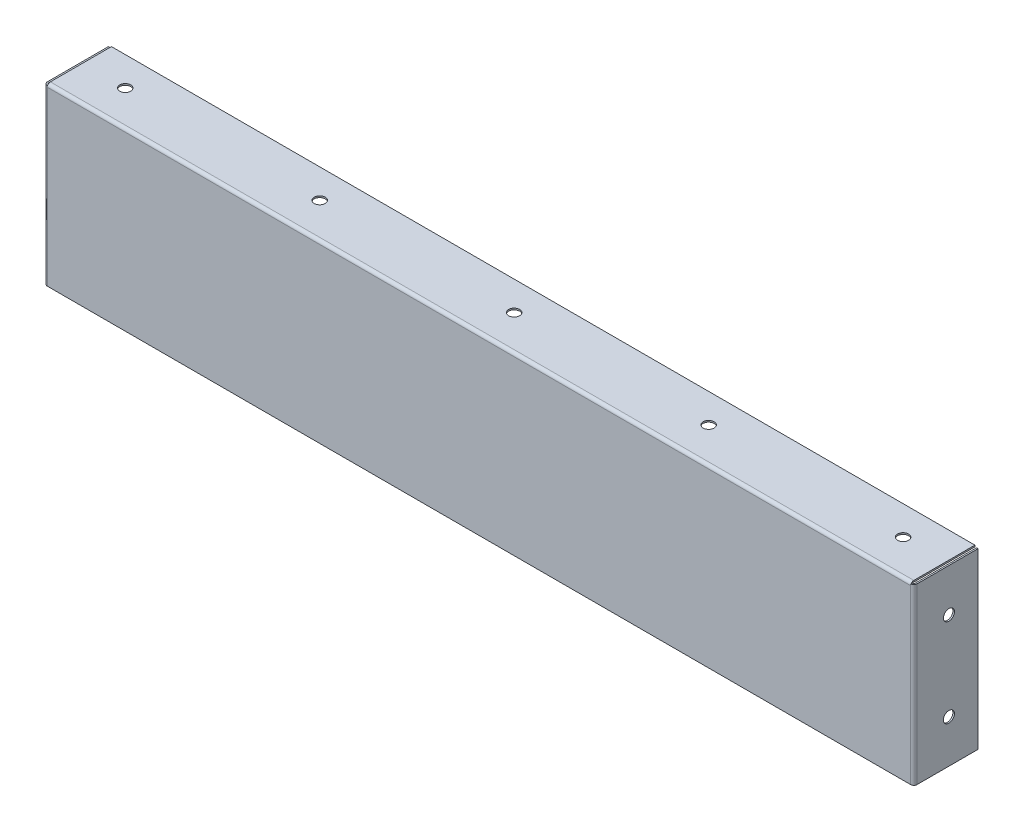
from build123d import *

# Parameters (mm, degrees)
SKETCH1_W                    = 514.4008
SKETCH1_H                    = 103.2002
BOSS_EXTRUDE1_DEPTH          = 1.6002
CONVERT_SOLID1_OUTLINE_W     = 514.4008
CONVERT_SOLID1_OUTLINE_H     = 103.2002
CONVERT_SOLID1_DEPTH         = 0.6858
EDGE_FLANGE1_STRIP_W         = 5.4864
EDGE_FLANGE1_STRIP_H         = 0.9144
EDGE_FLANGE1_STRIP_CUT_DEPTH = 103.2002
EDGE_FLANGE1_DEPTH           = 103.2002
EDGE_FLANGE2_STRIP_W         = 5.4864
EDGE_FLANGE2_STRIP_H         = 0.9144
EDGE_FLANGE2_STRIP_CUT_DEPTH = 103.2002
EDGE_FLANGE2_DEPTH           = 103.2002
CUT_EXTRUDE3_DEPTH           = 521.084421643
CUT_EXTRUDE3_DEPTH_BACK      = 521.084421643
SKETCH18_R                   = 3.2639
EDGE_FLANGE3_STRIP_W         = 5.4864
EDGE_FLANGE3_STRIP_H         = 0.9144
EDGE_FLANGE3_STRIP_CUT_DEPTH = 512.572
EDGE_FLANGE3_DEPTH           = 512.572
SKETCH22_R                   = 3.2639
CUT_EXTRUDE4_DEPTH           = 2.54


# Read off the part's stored shape, not the designer's step: Convert-Solid1
# Sheet-metal steps are written as plain solids
with BuildPart() as part:
    # Sketch1 → Boss-Extrude1 (new body)
    with BuildSketch(Plane.XY):
        Rectangle(SKETCH1_W, SKETCH1_H)
    extrude(amount=BOSS_EXTRUDE1_DEPTH)

    # Convert-Solid1 outline → Convert-Solid1 (cut)
    with BuildSketch(Plane.XY):
        Rectangle(CONVERT_SOLID1_OUTLINE_W, CONVERT_SOLID1_OUTLINE_H)
    extrude(amount=CONVERT_SOLID1_DEPTH, mode=Mode.SUBTRACT)

    # Edge-Flange1 strip (across the edge) → Edge-Flange1 strip cut (cut)
    with BuildSketch(Plane(origin=(257.2004, 51.6001, 0.6858), x_dir=(-1, 0, 0), z_dir=(0, -1, 0))):
        with Locations((-1.8288, -0.4572)):
            Rectangle(EDGE_FLANGE1_STRIP_W, EDGE_FLANGE1_STRIP_H)
    extrude(amount=EDGE_FLANGE1_STRIP_CUT_DEPTH, mode=Mode.SUBTRACT)

    # Edge-Flange1 section (across the edge) → Edge-Flange1 (add)
    with BuildSketch(Plane(origin=(257.2004, 51.6001, 0.6858), x_dir=(-1, 0, 0), z_dir=(0, -1, 0))):
        with BuildLine():
            Line((-0.9144, 0.9144), (-0.9144, 37.1856))
            Line((-0.9144, 37.1856), (0, 37.1856))
            Line((0, 37.1856), (0, 0.9144))
            ThreePointArc((0, 0.9144), (0.267821559, 0.267821559), (0.9144, 0))
            Line((0.9144, 0), (0.9144, -0.9144))
            ThreePointArc((0.9144, -0.9144), (-0.378756881, -0.378756881), (-0.9144, 0.9144))
        make_face()
    extrude(amount=EDGE_FLANGE1_DEPTH)

    # Edge-Flange2 strip (across the edge) → Edge-Flange2 strip cut (cut)
    with BuildSketch(Plane(origin=(-257.2004, -51.6001, 0.6858), x_dir=(1, 0, 0), z_dir=(0, 1, 0))):
        with Locations((-1.8288, -0.4572)):
            Rectangle(EDGE_FLANGE2_STRIP_W, EDGE_FLANGE2_STRIP_H)
    extrude(amount=EDGE_FLANGE2_STRIP_CUT_DEPTH, mode=Mode.SUBTRACT)

    # Edge-Flange2 section (across the edge) → Edge-Flange2 (add)
    with BuildSketch(Plane(origin=(-257.2004, -51.6001, 0.6858), x_dir=(1, 0, 0), z_dir=(0, 1, 0))):
        with BuildLine():
            Line((-0.9144, 0.9144), (-0.9144, 37.1856))
            Line((-0.9144, 37.1856), (0, 37.1856))
            Line((0, 37.1856), (0, 0.9144))
            ThreePointArc((0, 0.9144), (0.267821559, 0.267821559), (0.9144, 0))
            Line((0.9144, 0), (0.9144, -0.9144))
            ThreePointArc((0.9144, -0.9144), (-0.378756881, -0.378756881), (-0.9144, 0.9144))
        make_face()
    extrude(amount=EDGE_FLANGE2_DEPTH)

    # Sketch18 → Cut-Extrude3 (cut, two sides: drawn at the far end of the back side and taken through both)
    with BuildSketch(Plane.ZY.offset(258.1148).offset(-CUT_EXTRUDE3_DEPTH_BACK)):
        with Locations(Location((-19.244729261, 26.2001, 0), (0, 0, 180))):
            Circle(SKETCH18_R)
        with Locations(Location((-19.244729261, -26.2001, 0), (0, 0, 180))):
            Circle(SKETCH18_R)
    extrude(amount=CUT_EXTRUDE3_DEPTH + CUT_EXTRUDE3_DEPTH_BACK, mode=Mode.SUBTRACT)

    # Edge-Flange3 strip (across the edge) → Edge-Flange3 strip cut (cut)
    with BuildSketch(Plane(origin=(-256.286, 51.6001, 0.6858), x_dir=(0, -1, 0), z_dir=(1, 0, 0))):
        with Locations((-1.8288, -0.4572)):
            Rectangle(EDGE_FLANGE3_STRIP_W, EDGE_FLANGE3_STRIP_H)
    extrude(amount=EDGE_FLANGE3_STRIP_CUT_DEPTH, mode=Mode.SUBTRACT)

    # Edge-Flange3 section (across the edge) → Edge-Flange3 (add)
    with BuildSketch(Plane(origin=(-256.286, 51.6001, 0.6858), x_dir=(0, -1, 0), z_dir=(1, 0, 0))):
        with BuildLine():
            Line((-0.9144, 0.9144), (-0.9144, 37.1856))
            Line((-0.9144, 37.1856), (0, 37.1856))
            Line((0, 37.1856), (0, 0.9144))
            ThreePointArc((0, 0.9144), (0.267821559, 0.267821559), (0.9144, 0))
            Line((0.9144, 0), (0.9144, -0.9144))
            ThreePointArc((0.9144, -0.9144), (-0.378756881, -0.378756881), (-0.9144, 0.9144))
        make_face()
    extrude(amount=EDGE_FLANGE3_DEPTH)

    # Sketch22 → Cut-Extrude4 (cut)
    with BuildSketch(Plane(origin=(0, 52.5145, 0), x_dir=(1, 0, 0), z_dir=(0, 1, 0))):
        with Locations(Location((230.886, 19.2786, 0), (0, 0, 270))):
            Circle(SKETCH22_R)
        with Locations(Location((115.443, 19.2786, 0), (0, 0, 270))):
            Circle(SKETCH22_R)
        with Locations(Location((0, 19.2786, 0), (0, 0, 270))):
            Circle(SKETCH22_R)
        with Locations(Location((-115.443, 19.2786, 0), (0, 0, 270))):
            Circle(SKETCH22_R)
        with Locations(Location((-230.886, 19.2786, 0), (0, 0, 270))):
            Circle(SKETCH22_R)
    extrude(amount=-CUT_EXTRUDE4_DEPTH, mode=Mode.SUBTRACT)


solid = part.part
